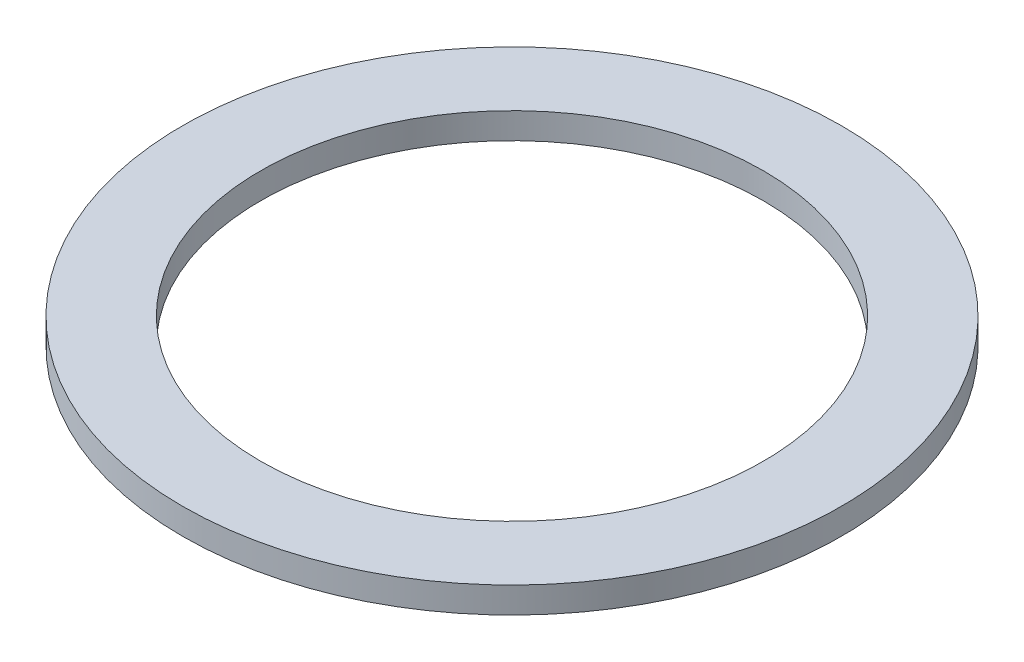
from build123d import *

# Parameters (mm, degrees)
SKETCH1_R           = 38
SKETCH1_R_2         = 29
BOSS_EXTRUDE1_DEPTH = 3


with BuildPart() as part:
    # Sketch1 → Boss-Extrude1 (new body)
    with BuildSketch(Plane(origin=(0, 0, 0), x_dir=(1, 0, 0), z_dir=(0, 1, 0))):
        Circle(SKETCH1_R)
        Circle(SKETCH1_R_2, mode=Mode.SUBTRACT)
    extrude(amount=BOSS_EXTRUDE1_DEPTH)


solid = part.part
